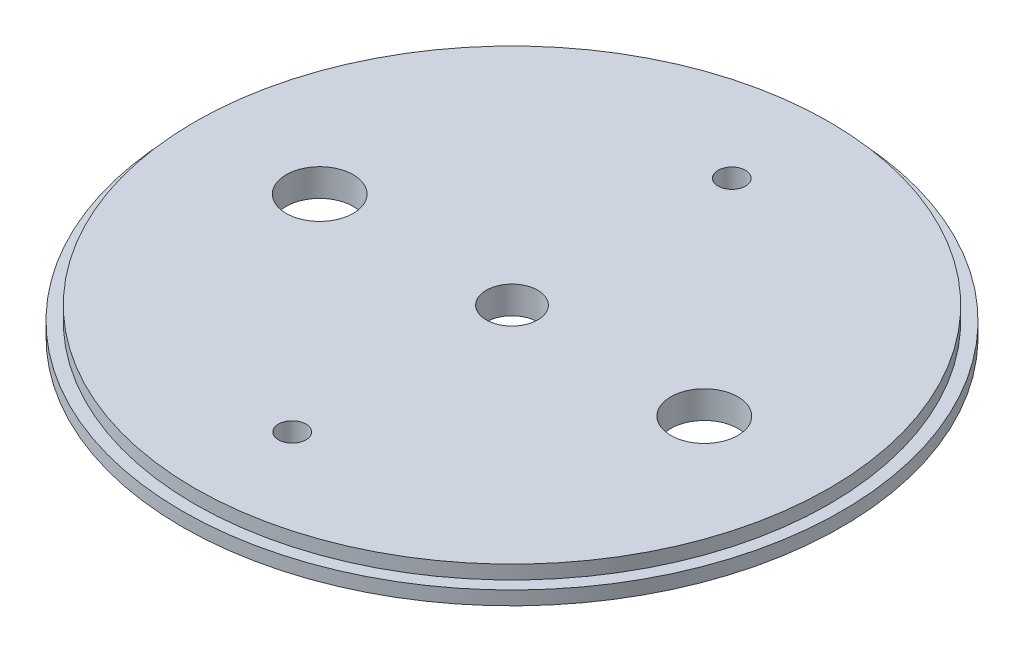
from build123d import *

# Parameters (mm, degrees)
SKETCH1_R                   = 76.1746
BOSS_EXTRUDE1_DEPTH         = 3.175
SKETCH1_3_R                 = 73.3425
BOSS_EXTRUDE2_DEPTH         = 6.35
F_1_4_0_25_DIAMETER_HOLE1_D = 6.35
M18X2_5_TAPPED_HOLE1_D      = 15.5
SKETCH3_3_R                 = 5.953125
CUT_EXTRUDE2_DEPTH          = 108.914141197


with BuildPart() as part:
    # Sketch1 → Boss-Extrude1 (new body)
    with BuildSketch(Plane(origin=(0, 0, 0), x_dir=(1, 0, 0), z_dir=(0, 1, 0))):
        Circle(SKETCH1_R)
    extrude(amount=BOSS_EXTRUDE1_DEPTH)

    # Sketch1<3> → Boss-Extrude2 (add)
    with BuildSketch(Plane(origin=(0, 0, 0), x_dir=(1, 0, 0), z_dir=(0, 1, 0))):
        Circle(SKETCH1_3_R)
    extrude(amount=BOSS_EXTRUDE2_DEPTH)

    # 1/4 (0.25) Diameter Hole1 (through all)
    with Locations(Plane(origin=(0, 0, 0), x_dir=(-1, 0, 0), z_dir=(0, -1, 0))):
        with Locations((0, 50.8), (0, -50.8)):
            Hole(F_1_4_0_25_DIAMETER_HOLE1_D / 2)

    # M18x2.5 Tapped Hole1 (through all)
    with Locations(Plane(origin=(0, 0, 0), x_dir=(-1, 0, 0), z_dir=(0, -1, 0))):
        with Locations((44.45, 0), (-44.45, 0)):
            Hole(M18X2_5_TAPPED_HOLE1_D / 2)

    # Sketch3<3> → Cut-Extrude2 (cut, through all)
    with BuildSketch(Plane.XZ):
        Circle(SKETCH3_3_R)
    extrude(amount=-CUT_EXTRUDE2_DEPTH, mode=Mode.SUBTRACT)


solid = part.part
